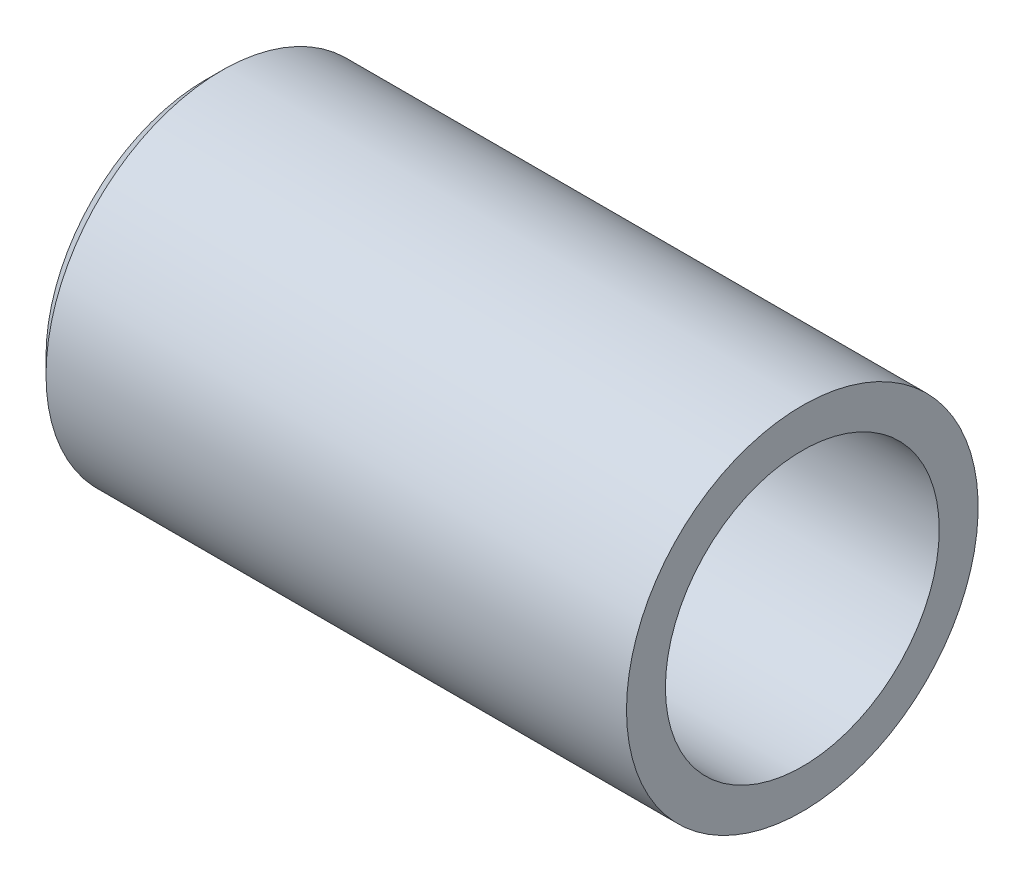
from build123d import *


with BuildPart() as part:
    # Sketch1 → Revolve1 (revolve)
    with BuildSketch(Plane.XY):
        Polygon((6.703306228, 5.422749886), (24.60625, 5.422749886), (24.60625, 4.22275), (6.20625, 4.22275), (6.20625, 4.925693658), align=None)
    revolve(axis=Axis((0, 0, 0), (1, 0, 0)))


solid = part.part
